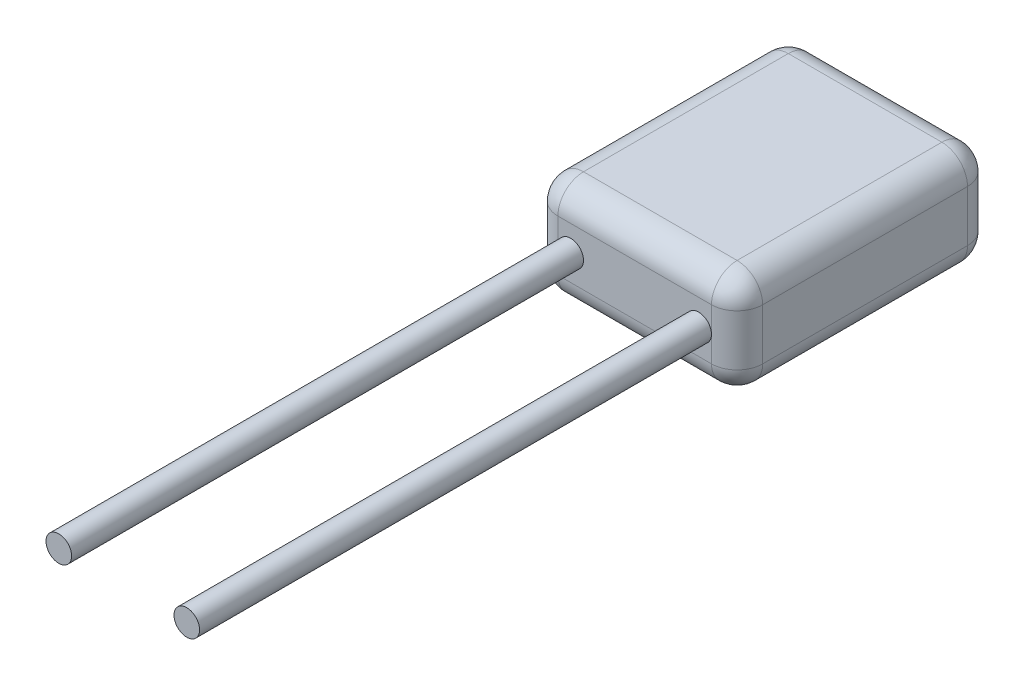
from build123d import *

# Parameters (mm, degrees)
SKETCH1_W           = 4
SKETCH1_H           = 2
BOSS_EXTRUDE1_DEPTH = 5
SKETCH2_R           = 0.25
BOSS_EXTRUDE2_DEPTH = 10
FILLET1_R           = 0.5


with BuildPart() as part:
    # Sketch1 → Boss-Extrude1 (new body)
    with BuildSketch(Plane.XY):
        Rectangle(SKETCH1_W, SKETCH1_H)
    extrude(amount=BOSS_EXTRUDE1_DEPTH)

    # Sketch2 → Boss-Extrude2 (add)
    with BuildSketch(Plane.XY.offset(5)):
        with Locations(Location((-1.25, 0, 0), (0, 0, 180))):
            Circle(SKETCH2_R)
        with Locations(Location((1.25, 0, 0), (0, 0, 180))):
            Circle(SKETCH2_R)
    extrude(amount=BOSS_EXTRUDE2_DEPTH)

    # Fillet1
    fillet1_edges = [part.edges().sort_by_distance(p)[0] for p in [
        (-2, 0, 5),
        (0, -1, 5),
        (2, 0, 5),
        (0, -1, 0),
        (-2, 0, 0),
        (0, 1, 0),
        (2, 0, 0),
        (0, 1, 5),
        (2, -1, 2.5),
        (-2, -1, 2.5),
        (-2, 1, 2.5),
        (2, 1, 2.5),
    ]]
    fillet(fillet1_edges, radius=FILLET1_R - 0.0001)  # a hair under: the kernel refuses the full size


solid = part.part
